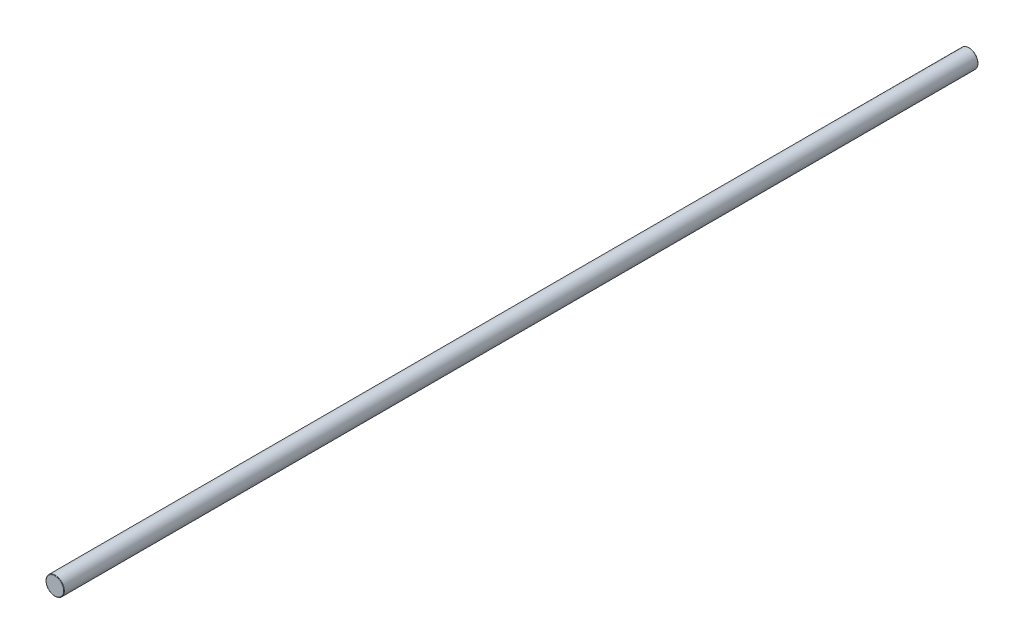
from build123d import *

# Parameters (mm, degrees)
SKETCH1_R           = 4
BOSS_EXTRUDE1_DEPTH = 400
FILLET1_R           = 0.2


with BuildPart() as part:
    # Sketch1 → Boss-Extrude1 (new body)
    with BuildSketch(Plane.XY):
        Circle(SKETCH1_R)
    extrude(amount=-BOSS_EXTRUDE1_DEPTH)

    # Fillet1
    fillet1_edges = [part.edges().sort_by_distance(p)[0] for p in [
        (-4, 0, -400),
        (-4, 0, 0),
    ]]
    fillet(fillet1_edges, radius=FILLET1_R)


solid = part.part
